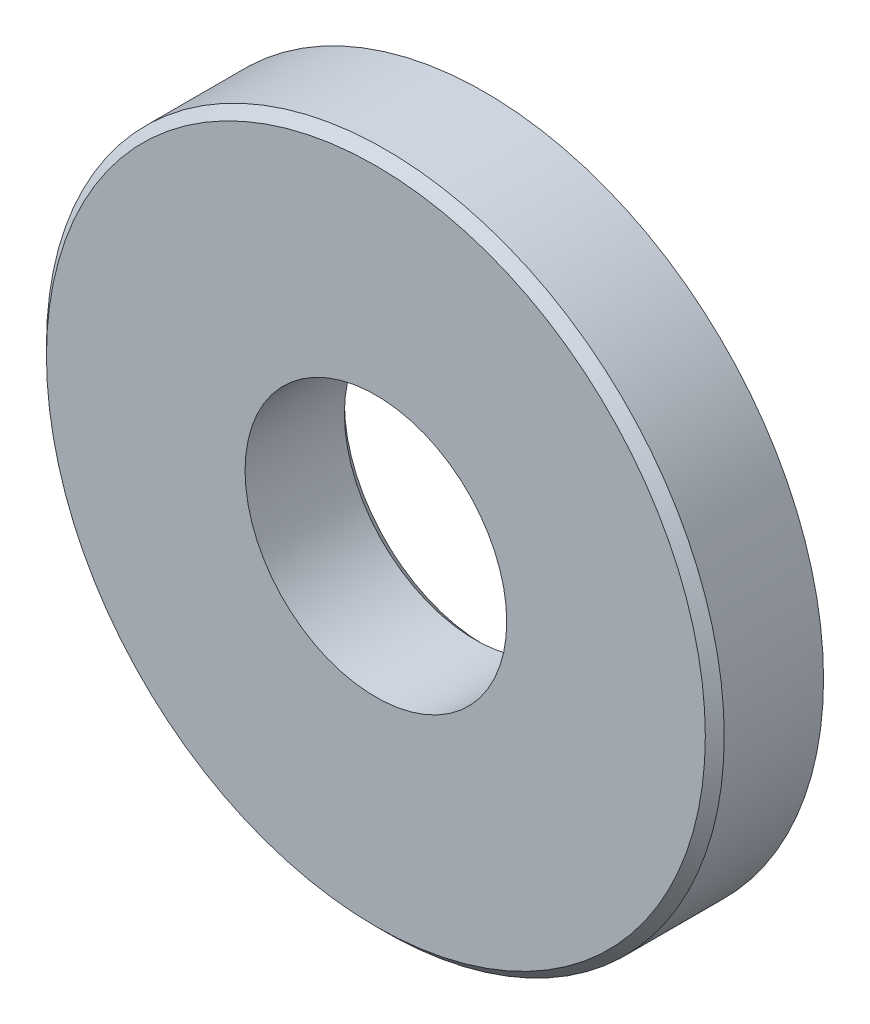
from build123d import *

# Parameters (mm, degrees)
SKETCH_1_R      = 10.75
SKETCH_1_R_2    = 4.15
EXTRUDE_1_DEPTH = 3.45
CHAMFER_1_SIZE  = 0.3
CHAMFER_2_SIZE  = 0.3


with BuildPart() as part:
    # 草图1 → 凸台-拉伸1 (new body)
    with BuildSketch(Plane.XY):
        Circle(SKETCH_1_R)
        Circle(SKETCH_1_R_2, mode=Mode.SUBTRACT)
    extrude(amount=EXTRUDE_1_DEPTH)

    # 倒角1
    chamfer_1_edges = [part.edges().sort_by_distance(p)[0] for p in [
        (-10.75, 0, 3.45),
    ]]
    chamfer(chamfer_1_edges, length=CHAMFER_1_SIZE)

    # 倒角2
    chamfer_2_edges = [part.edges().sort_by_distance(p)[0] for p in [
        (-4.15, 0, 0),
    ]]
    chamfer(chamfer_2_edges, length=CHAMFER_2_SIZE)


solid = part.part
